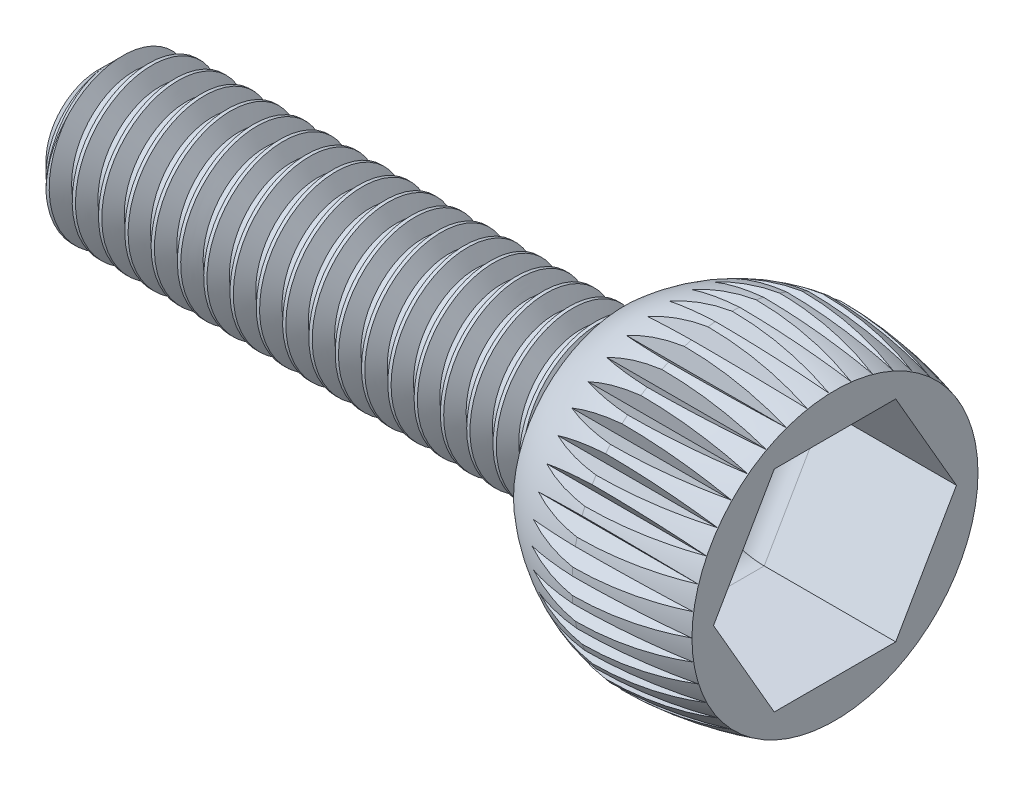
from build123d import *

# Parameters (mm, degrees)
SKETCH1_R           = 3
BOSS_EXTRUDE1_DEPTH = 20
SKETCH4_R           = 6
BOSS_EXTRUDE2_DEPTH = 8
CUT_EXTRUDE1_START  = -8
CUT_EXTRUDE1_DEPTH  = 8
CUT_EXTRUDE2_DEPTH  = 6
FILLET1_R           = 1
CHAMFER1_SIZE       = 1
THREAD2_PITCH       = 1


# Read off the part's stored shape, not the designer's step: Cut-Revolve1
with BuildPart() as part:
    # Sketch1 → Boss-Extrude1 (new body)
    with BuildSketch(Plane(origin=(0, 0, 0), x_dir=(0, 0, -1), z_dir=(1, 0, 0))):
        Circle(SKETCH1_R)
    extrude(amount=BOSS_EXTRUDE1_DEPTH)

    # Sketch4 → Boss-Extrude2 (add)
    with BuildSketch(Plane(origin=(20, 0, 0), x_dir=(0, 0, -1), z_dir=(1, 0, 0))):
        Circle(SKETCH4_R)
    extrude(amount=BOSS_EXTRUDE2_DEPTH)

    # Sketch5 → Cut-Extrude1 (cut)
    with BuildSketch(Plane(origin=(28, 0, 0), x_dir=(0, 0, -1), z_dir=(1, 0, 0)).offset(CUT_EXTRUDE1_START)):
        with BuildLine():
            Line((-5.991551408, -0.318295029), (-5.440248245, 0))
            Line((-5.440248245, 0), (-5.991551408, 0.318295029))
            ThreePointArc((-5.991551408, 0.318295029), (-6, 0), (-5.991551408, -0.318295029))
        make_face()
        with BuildLine():
            Line((-5.969920473, 0.600041287), (-5.376490841, 0.830450001))
            Line((-5.376490841, 0.830450001), (-5.872745456, 1.22917078))
            ThreePointArc((-5.872745456, 1.22917078), (-5.929682543, 0.915895705), (-5.969920473, 0.600041287))
        make_face()
        with BuildLine():
            Line((-5.872745456, -1.22917078), (-5.376490841, -0.830450001))
            Line((-5.376490841, -0.830450001), (-5.969920473, -0.600041287))
            ThreePointArc((-5.969920473, -0.600041287), (-5.929682543, -0.915895705), (-5.872745456, -1.22917078))
        make_face()
        with BuildLine():
            Line((-5.808359662, 1.504313145), (-5.186713049, 1.641434957))
            Line((-5.186713049, 1.641434957), (-5.616287328, 2.11123581))
            ThreePointArc((-5.616287328, 2.11123581), (-5.720378352, 1.810323592), (-5.808359662, 1.504313145))
        make_face()
        with BuildLine():
            Line((-5.616287328, -2.11123581), (-5.186713049, -1.641434957))
            Line((-5.186713049, -1.641434957), (-5.808359662, -1.504313145))
            ThreePointArc((-5.808359662, -1.504313145), (-5.720378352, -1.810323592), (-5.616287328, -2.11123581))
        make_face()
        with BuildLine():
            Line((-5.510655823, 2.373325177), (-4.875363099, 2.413946069))
            Line((-4.875363099, 2.413946069), (-5.228188186, 2.943815262))
            ThreePointArc((-5.228188186, 2.943815262), (-5.376993342, 2.662319027), (-5.510655823, 2.373325177))
        make_face()
        with BuildLine():
            Line((-5.228188186, -2.943815262), (-4.875363099, -2.413946069))
            Line((-4.875363099, -2.413946069), (-5.510655823, -2.373325177))
            ThreePointArc((-5.510655823, -2.373325177), (-5.376993342, -2.662319027), (-5.228188186, -2.943815262))
        make_face()
        with BuildLine():
            Line((-5.083786883, 3.186708479), (-4.44973877, 3.129876332))
            Line((-4.44973877, 3.129876332), (-4.717544743, 3.707394179))
            ThreePointArc((-4.717544743, 3.707394179), (-4.907576165, 3.451911961), (-5.083786883, 3.186708479))
        make_face()
        with BuildLine():
            Line((-4.717544743, -3.707394179), (-4.44973877, -3.129876332))
            Line((-4.44973877, -3.129876332), (-5.083786883, -3.186708479))
            ThreePointArc((-5.083786883, -3.186708479), (-4.907576165, -3.451911961), (-4.717544743, -3.707394179))
        make_face()
        with BuildLine():
            Line((-4.537758287, 3.925398035), (-3.919816335, 3.772444946))
            Line((-3.919816335, 3.772444946), (-4.09632605, 4.384074918))
            ThreePointArc((-4.09632605, 4.384074918), (-4.323129562, 4.160595005), (-4.537758287, 3.925398035))
        make_face()
        with BuildLine():
            Line((-4.09632605, -4.384074918), (-3.919816335, -3.772444946))
            Line((-3.919816335, -3.772444946), (-4.537758287, -3.925398035))
            ThreePointArc((-4.537758287, -3.925398035), (-4.323129562, -4.160595005), (-4.09632605, -4.384074918))
        make_face()
        with BuildLine():
            Line((-3.885368482, 4.572079588), (-3.298016728, 4.326590647))
            Line((-3.298016728, 4.326590647), (-3.379092947, 4.957996658))
            ThreePointArc((-3.379092947, 4.957996658), (-3.637352466, 4.771757228), (-3.885368482, 4.572079588))
        make_face()
        with BuildLine():
            Line((-3.379092947, -4.957996658), (-3.298016728, -4.326590647))
            Line((-3.298016728, -4.326590647), (-3.885368482, -4.572079588))
            ThreePointArc((-3.885368482, -4.572079588), (-3.637352466, -4.771757228), (-3.379092947, -4.957996658))
        make_face()
        with BuildLine():
            Line((-3.141908934, 5.11159547), (-2.598914404, 4.779324731))
            Line((-2.598914404, 4.779324731), (-2.582656768, 5.415707158))
            ThreePointArc((-2.582656768, 5.415707158), (-2.866318911, 5.271073505), (-3.141908934, 5.11159547))
        make_face()
        with BuildLine():
            Line((-2.582656768, -5.415707158), (-2.598914404, -4.779324731))
            Line((-2.598914404, -4.779324731), (-3.141908934, -5.11159547))
            ThreePointArc((-3.141908934, -5.11159547), (-2.866318911, -5.271073505), (-2.582656768, -5.415707158))
        make_face()
        with BuildLine():
            Line((-2.324805703, 5.531299887), (-1.83889573, 5.120035494))
            Line((-1.83889573, 5.120035494), (-1.725685304, 5.746478072))
            ThreePointArc((-1.725685304, 5.746478072), (-2.02810127, 5.646840288), (-2.324805703, 5.531299887))
        make_face()
        with BuildLine():
            Line((-1.725685304, -5.746478072), (-1.83889573, -5.120035494))
            Line((-1.83889573, -5.120035494), (-2.324805703, -5.531299887))
            ThreePointArc((-2.324805703, -5.531299887), (-2.02810127, -5.646840288), (-1.725685304, -5.746478072))
        make_face()
        with BuildLine():
            Line((-1.453210997, 5.821355323), (-1.035774898, 5.340736965))
            Line((-1.035774898, 5.340736965), (-0.82826524, 5.942556411))
            ThreePointArc((-0.82826524, 5.942556411), (-1.142346655, 5.89024992), (-1.453210997, 5.821355323))
        make_face()
        with BuildLine():
            Line((-0.82826524, -5.942556411), (-1.035774898, -5.340736965))
            Line((-1.035774898, -5.340736965), (-1.453210997, -5.821355323))
            ThreePointArc((-1.453210997, -5.821355323), (-1.142346655, -5.89024992), (-0.82826524, -5.942556411))
        make_face()
        with BuildLine():
            Line((-0.547554256, 5.974963124), (-0.20837638, 5.436256088))
            Line((-0.20837638, 5.436256088), (0.088568661, 5.999346264))
            ThreePointArc((0.088568661, 5.999346264), (-0.229816402, 5.995597086), (-0.547554256, 5.974963124))
        make_face()
        with BuildLine():
            Line((0.088568661, -5.999346264), (-0.20837638, -5.436256088))
            Line((-0.20837638, -5.436256088), (-0.547554256, -5.974963124))
            ThreePointArc((-0.547554256, -5.974963124), (-0.229816402, -5.995597086), (0.088568661, -5.999346264))
        make_face()
        with BuildLine():
            Line((0.370936692, 5.988522854), (0.623906304, 5.404353976))
            Line((0.623906304, 5.404353976), (1.003326586, 5.915516525))
            ThreePointArc((1.003326586, 5.915516525), (0.688100552, 5.960412539), (0.370936692, 5.988522854))
        make_face()
        with BuildLine():
            Line((1.003326586, -5.915516525), (0.623906304, -5.404353976))
            Line((0.623906304, -5.404353976), (0.370936692, -5.988522854))
            ThreePointArc((0.370936692, -5.988522854), (0.688100552, -5.960412539), (1.003326586, -5.915516525))
        make_face()
        with BuildLine():
            Line((1.280733198, 5.861716683), (1.441565152, 5.245778387))
            Line((1.441565152, 5.245778387), (1.894567387, 5.693032093))
            ThreePointArc((1.894567387, 5.693032093), (1.589889013, 5.785520973), (1.280733198, 5.861716683))
        make_face()
        with BuildLine():
            Line((1.894567387, -5.693032093), (1.441565152, -5.245778387))
            Line((1.441565152, -5.245778387), (1.280733198, -5.861716683))
            ThreePointArc((1.280733198, -5.861716683), (1.589889013, -5.785520973), (1.894567387, -5.693032093))
        make_face()
        with BuildLine():
            Line((2.160510404, 5.597516842), (2.225434936, 4.964246198))
            Line((2.225434936, 4.964246198), (2.741401134, 5.337107814))
            ThreePointArc((2.741401134, 5.337107814), (2.454411823, 5.475021699), (2.160510404, 5.597516842))
        make_face()
        with BuildLine():
            Line((2.741401134, -5.337107814), (2.225434936, -4.964246198))
            Line((2.225434936, -4.964246198), (2.160510404, -5.597516842))
            ThreePointArc((2.160510404, -5.597516842), (2.454411823, -5.475021699), (2.741401134, -5.337107814))
        make_face()
        with BuildLine():
            Line((2.989647077, 5.20211595), (2.95714241, 4.566356287))
            Line((2.95714241, 4.566356287), (3.523978763, 4.856086251))
            ThreePointArc((3.523978763, 4.856086251), (3.2614053, 5.036192557), (2.989647077, 5.20211595))
        make_face()
        with BuildLine():
            Line((3.523978763, -4.856086251), (2.95714241, -4.566356287))
            Line((2.95714241, -4.566356287), (2.989647077, -5.20211595))
            ThreePointArc((2.989647077, -5.20211595), (3.2614053, -5.036192557), (3.523978763, -4.856086251))
        make_face()
        with BuildLine():
            Line((3.748708956, 4.684781869), (3.619536973, 4.061434854))
            Line((3.619536973, 4.061434854), (4.223957315, 4.261242143))
            ThreePointArc((4.223957315, 4.261242143), (3.991954201, 4.47931933), (3.748708956, 4.684781869))
        make_face()
        with BuildLine():
            Line((4.223957315, -4.261242143), (3.619536973, -4.061434854))
            Line((3.619536973, -4.061434854), (3.748708956, -4.684781869))
            ThreePointArc((3.748708956, -4.684781869), (3.991954201, -4.47931933), (4.223957315, -4.261242143))
        make_face()
        with BuildLine():
            Line((4.419904275, 4.057640472), (4.197092657, 3.46131683))
            Line((4.197092657, 3.46131683), (4.824929888, 3.56651813))
            ThreePointArc((4.824929888, 3.56651813), (4.628935079, 3.817454654), (4.419904275, 4.057640472))
        make_face()
        with BuildLine():
            Line((4.824929888, -3.56651813), (4.197092657, -3.46131683))
            Line((4.197092657, -3.46131683), (4.419904275, -4.057640472))
            ThreePointArc((4.419904275, -4.057640472), (4.628935079, -3.817454654), (4.824929888, -3.56651813))
        make_face()
        with BuildLine():
            Line((4.987500783, 3.335391422), (4.676272046, 2.780068474))
            Line((4.676272046, 2.780068474), (5.312810195, 2.788197955))
            ThreePointArc((5.312810195, 2.788197955), (5.157417642, 3.066112077), (4.987500783, 3.335391422))
        make_face()
        with BuildLine():
            Line((5.312810195, -2.788197955), (4.676272046, -2.780068474))
            Line((4.676272046, -2.780068474), (4.987500783, -3.335391422))
            ThreePointArc((4.987500783, -3.335391422), (5.157417642, -3.066112077), (5.312810195, -2.788197955))
        make_face()
        with BuildLine():
            Line((5.438194501, 2.534963623), (5.045843582, 2.033657669))
            Line((5.045843582, 2.033657669), (5.676162733, 1.944524783))
            ThreePointArc((5.676162733, 1.944524783), (5.565014707, 2.242902431), (5.438194501, 2.534963623))
        make_face()
        with BuildLine():
            Line((5.676162733, -1.944524783), (5.045843582, -2.033657669))
            Line((5.045843582, -2.033657669), (5.438194501, -2.534963623))
            ThreePointArc((5.438194501, -2.534963623), (5.565014707, -2.242902431), (5.676162733, -1.944524783))
        make_face()
        with BuildLine():
            Line((5.761421549, 1.675118426), (5.297144821, 1.239579652))
            Line((5.297144821, 1.239579652), (5.906470827, 1.055273598))
            ThreePointArc((5.906470827, 1.055273598), (5.842172543, 1.367121053), (5.761421549, 1.675118426))
        make_face()
        with BuildLine():
            Line((5.906470827, -1.055273598), (5.297144821, -1.239579652))
            Line((5.297144821, -1.239579652), (5.761421549, -1.675118426))
            ThreePointArc((5.761421549, -1.675118426), (5.842172543, -1.367121053), (5.906470827, -1.055273598))
        make_face()
        with BuildLine():
            Line((5.949605758, 0.776009872), (5.424285475, 0.416446938))
            Line((5.424285475, 0.416446938), (5.998336252, 0.141287695))
            ThreePointArc((5.998336252, 0.141287695), (5.982394807, 0.459295517), (5.949605758, 0.776009872))
        make_face()
        with BuildLine():
            Line((5.998336252, -0.141287695), (5.424285475, -0.416446938))
            Line((5.424285475, -0.416446938), (5.949605758, -0.776009872))
            ThreePointArc((5.949605758, -0.776009872), (5.982394807, -0.459295517), (5.998336252, -0.141287695))
        make_face()
    extrude(amount=CUT_EXTRUDE1_DEPTH, mode=Mode.SUBTRACT)

    # Cut-Revolve1 outline → Cut-Revolve1 (revolve, cut)
    with BuildSketch(Plane.YX):
        with BuildLine():
            Line((6, 20), (6, 24.000000001))
            ThreePointArc((6, 24.000000001), (5.419004691, 21.863677165), (4.223957315, 20))
            Line((4.223957315, 20), (6, 20))
        make_face()
        with BuildLine():
            ThreePointArc((5.438194501, 28), (5.858862717, 26.019630252), (6, 24))
            Line((6, 24), (6, 28))
            Line((6, 28), (5.438194501, 28))
        make_face()
    revolve(axis=Axis((0, 0, 0), (1, 0, 0)), mode=Mode.SUBTRACT)

    # Sketch8 → Cut-Extrude2 (cut)
    with BuildSketch(Plane(origin=(28, 0, 0), x_dir=(0, 0, -1), z_dir=(1, 0, 0))):
        Polygon((4.618802154, 0), (2.309401077, 4), (-2.309401077, 4), (-4.618802154, 0), (-2.309401077, -4), (2.309401077, -4), align=None)
    extrude(amount=-CUT_EXTRUDE2_DEPTH, mode=Mode.SUBTRACT)

    # Fillet1
    fillet1_edges = [part.edges().sort_by_distance(p)[0] for p in [
        (22, -2, -3.464101615),
        (22, -4, 0),
        (22, -2, 3.464101615),
        (22, 2, 3.464101615),
        (22, 4, 0),
        (22, 2, -3.464101615),
    ]]
    fillet(fillet1_edges, radius=FILLET1_R)

    # Chamfer1
    chamfer1_edges = [part.edges().sort_by_distance(p)[0] for p in [
        (0, 0, 3),
    ]]
    chamfer(chamfer1_edges, length=CHAMFER1_SIZE)

    # Thread2: the profile of Thread Profile2 profile screwed along a right-hand helix of 20 turns, 8 arcs to a turn; built about Z, then put on its axis
    thread2_z = Axis((0, 0, 0), (0, 0, 1))
    thread2_corners = [(3.0003, 0, -0.000173205), (3.0003, 0, 0.875173202), (2.458734125, 0, 0.562499999), (2.458734125, 0, 0.312499999)]
    with BuildLine(mode=Mode.PRIVATE) as thread2_profile:
        Line(thread2_corners[0], thread2_corners[1])
        Line(thread2_corners[1], thread2_corners[2])
        Line(thread2_corners[2], thread2_corners[3])
        Line(thread2_corners[3], thread2_corners[0])
    thread2_cap = Face(thread2_profile.wire())
    thread2_turn_angles = [0, 22.5, 45, 67.5, 90, 112.5, 135, 157.5, 180, 202.5, 225, 247.5, 270, 292.5, 315, 337.5, 360]
    thread2_turn_weights = [1, 0.9238795325112867, 1, 0.9238795325112867, 1, 0.9238795325112867, 1, 0.9238795325112867, 1, 0.9238795325112867, 1, 0.9238795325112867, 1, 0.9238795325112867, 1, 0.9238795325112867, 1]
    thread2_turn_rails = [Edge.make_bspline([Vector(p[0], p[1], 0).rotate(thread2_z, thread2_turn_angles[k]) / thread2_turn_weights[k] + Vector(0, 0, p[2] + THREAD2_PITCH * thread2_turn_angles[k] / 360) for k in range(17)], [0, 0, 0, 1, 1, 2, 2, 3, 3, 4, 4, 5, 5, 6, 6, 7, 7, 8, 8, 8], 2, thread2_turn_weights) for p in thread2_corners]
    thread2_turn_sides = [Face.make_surface_from_curves(thread2_turn_rails[p[0]], thread2_turn_rails[p[1]]) for p in [(0, 1), (1, 2), (2, 3), (3, 0)]]
    thread2 = Plane(origin=(20, 0, 0), x_dir=(0, 0, 1), z_dir=(-1, 0, 0)) * Solid(Shell([*[p.moved(Location((0, 0, THREAD2_PITCH * i))) for i in range(20) for p in thread2_turn_sides], thread2_cap, thread2_cap.rotate(thread2_z, 7200).moved(Location((0, 0, THREAD2_PITCH * 7200 / 360)))]))
    add(thread2, mode=Mode.SUBTRACT)


solid = part.part
